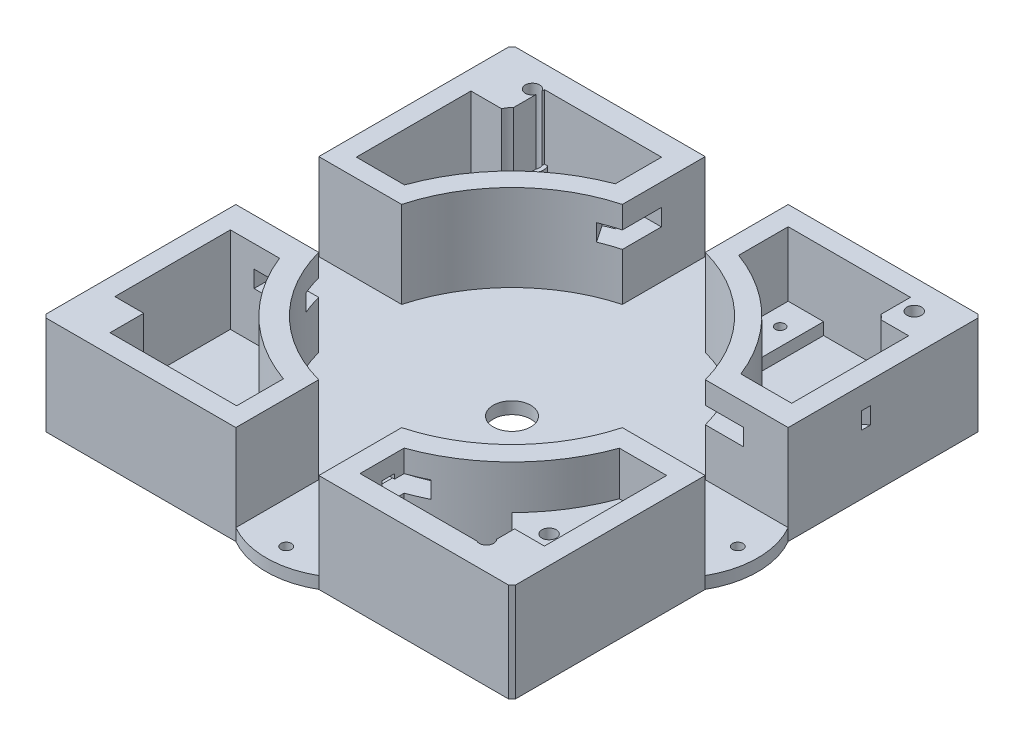
from build123d import *

# Parameters (mm, degrees)
BOSS_EXTRUDE1_DEPTH                  = 20.5
CUT_EXTRUDE4_REACH                   = 103.081
SKETCH2_R                            = 4.5
SKETCH2_R_2                          = 1.5
SKETCH2_R_3                          = 4.9
SKETCH2_R_4                          = 1
SKETCH2_R_5                          = 3.9
SKETCH2_R_6                          = 1.1
CUT_EXTRUDE7_START                   = -18
SKETCH3_R                            = 1.1
SKETCH3_R_2                          = 3.9
CUT_EXTRUDE7_DEPTH                   = 18
CUT_EXTRUDE8_START                   = -17.9
SKETCH4_R                            = 1.5
CUT_EXTRUDE8_DEPTH                   = 17.9
CUT_EXTRUDE9_START                   = -13.4
SKETCH5_R                            = 1.1
SKETCH5_R_2                          = 1
CUT_EXTRUDE9_DEPTH                   = 13.4
CUT_EXTRUDE10_START                  = -2.5
CUT_EXTRUDE10_DEPTH                  = 2.5
CUT_EXTRUDE11_START                  = -13.4
SKETCH7_R                            = 1
CUT_EXTRUDE11_DEPTH                  = 13.4
CUT_EXTRUDE12_START                  = -2.5
CUT_EXTRUDE12_DEPTH                  = 2.5
CUT_EXTRUDE13_START                  = -9.1
CUT_EXTRUDE13_DEPTH                  = 9.1
CUT_EXTRUDE14_START                  = -6.9
CUT_EXTRUDE14_DEPTH                  = 6.9
SKETCH11_W                           = 2.6
SKETCH11_H                           = 3.5
SKETCH11_W_2                         = 4.5
SKETCH11_H_2                         = 1
SKETCH11_W_3                         = 5.4
CUT_EXTRUDE15_DEPTH                  = 3.930835307
CUT_EXTRUDE16_REACH                  = 109.77
CUT_EXTRUDE16_END_RADIUS             = 32.7
SKETCH12_W                           = 6.7
SKETCH12_H                           = 3.5
CUT_EXTRUDE16_DIRECTION_2_REACH      = 109.77
CUT_EXTRUDE16_DIRECTION_2_END_RADIUS = 37.142307365
CUT_EXTRUDE17_REACH                  = 110.843
CUT_EXTRUDE17_END_RADIUS             = 37.142307365
SKETCH13_W                           = 6.720651518
SKETCH13_H                           = 3.5
SKETCH14_W                           = 8.3
SKETCH14_H                           = 3.5
CUT_EXTRUDE18_DEPTH                  = 5.130835307
CUT_EXTRUDE19_REACH                  = 121.1
CUT_EXTRUDE19_END_RADIUS             = 37.185548268
SKETCH15_W                           = 4.2
SKETCH15_H                           = 3.5
CUT_EXTRUDE19_DIRECTION_2_REACH      = 121.1
CUT_EXTRUDE19_DIRECTION_2_END_RADIUS = 32.7
CUT_EXTRUDE20_START                  = -0.335282018
CUT_EXTRUDE20_OUTLINE_W              = 1.5
CUT_EXTRUDE20_OUTLINE_H              = 3.5
CUT_EXTRUDE20_DEPTH                  = 2.439354416
CUT_EXTRUDE21_START                  = -0.459863
SKETCH17_W                           = 4.566599086
SKETCH17_H                           = 3.5
CUT_EXTRUDE21_DEPTH                  = 0.459863
CIRPATTERN1_START                    = 12.4
CIRPATTERN1_DEPTH                    = 3.5
SKETCH18_W                           = 8.1
SKETCH18_H                           = 3.5
CUT_EXTRUDE22_DEPTH                  = 4.430835307
CUT_EXTRUDE23_REACH                  = 83.159
SKETCH19_W                           = 7.9
SKETCH19_H                           = 3.5
BOSS_EXTRUDE2_DEPTH                  = 6.1
SPLIT1_START                         = 20.5
SPLIT1_DEPTH                         = 6.1


# Read off the part's stored shape, not the designer's step: Cut-Extrude20, CirPattern1, Split1
with BuildPart() as part:
    # Sketch1 → Boss-Extrude1 (new body)
    with BuildSketch(Plane(origin=(0, 0, 0), x_dir=(1, 0, 0), z_dir=(0, 1, 0))):
        with BuildLine():
            ThreePointArc((8.619164693, 15), (0, 17.3), (-8.619164693, 15))
            Line((-8.619164693, 15), (-48.05, 15))
            Line((-48.05, 15), (-48.75, 14.3))
            Line((-48.75, 14.3), (-48.75, -25.130835307))
            ThreePointArc((-48.75, -25.130835307), (-51.05, -33.75), (-48.75, -42.369164693))
            Line((-48.75, -42.369164693), (-48.75, -81.8))
            Line((-48.75, -81.8), (-48.05, -82.5))
            Line((-48.05, -82.5), (-8.619164693, -82.5))
            ThreePointArc((-8.619164693, -82.5), (0, -84.8), (8.619164693, -82.5))
            Line((8.619164693, -82.5), (48.05, -82.5))
            Line((48.05, -82.5), (48.75, -81.8))
            Line((48.75, -81.8), (48.75, -42.369164693))
            ThreePointArc((48.75, -42.369164693), (51.05, -33.75), (48.75, -25.130835307))
            Line((48.75, -25.130835307), (48.75, 14.3))
            Line((48.75, 14.3), (48.05, 15))
            Line((48.05, 15), (8.619164693, 15))
        make_face()
    extrude(amount=BOSS_EXTRUDE1_DEPTH)

    # Sketch2 → Cut-Extrude4 (cut, up to next)
    with BuildSketch(Plane.XZ, mode=Mode.PRIVATE) as cut_extrude4_sk1:
        with Locations(Location((35.25, 68.6, 0), (0, 0, 270))):
            Circle(SKETCH2_R)
    cut_extrude4_tool1 = extrude(cut_extrude4_sk1.sketch, amount=-CUT_EXTRUDE4_REACH, mode=Mode.PRIVATE) & part.part
    # Sketch2 → Cut-Extrude4 (cut, up to next)
    with BuildSketch(Plane.XZ, mode=Mode.PRIVATE) as cut_extrude4_sk2:
        with Locations(Location((33.95, 60, 0), (0, 0, 270))):
            Circle(SKETCH2_R_2)
    cut_extrude4_tool2 = extrude(cut_extrude4_sk2.sketch, amount=-CUT_EXTRUDE4_REACH, mode=Mode.PRIVATE) & part.part
    # Sketch2 → Cut-Extrude4 (cut, up to next)
    with BuildSketch(Plane.XZ, mode=Mode.PRIVATE) as cut_extrude4_sk3:
        with Locations(Location((35.05, -1, 0), (0, 0, 270))):
            Circle(SKETCH2_R_3)
    cut_extrude4_tool3 = extrude(cut_extrude4_sk3.sketch, amount=-CUT_EXTRUDE4_REACH, mode=Mode.PRIVATE) & part.part
    # Sketch2 → Cut-Extrude4 (cut, up to next)
    with BuildSketch(Plane.XZ, mode=Mode.PRIVATE) as cut_extrude4_sk4:
        with Locations(Location((-38.7, -9.2, 0), (0, 0, 270))):
            Circle(SKETCH2_R_2)
    cut_extrude4_tool4 = extrude(cut_extrude4_sk4.sketch, amount=-CUT_EXTRUDE4_REACH, mode=Mode.PRIVATE) & part.part
    # Sketch2 → Cut-Extrude4 (cut, up to next)
    with BuildSketch(Plane.XZ, mode=Mode.PRIVATE) as cut_extrude4_sk5:
        with Locations(Location((39.45, 17.4, 0), (0, 0, 270))):
            Circle(SKETCH2_R_4)
    cut_extrude4_tool5 = extrude(cut_extrude4_sk5.sketch, amount=-CUT_EXTRUDE4_REACH, mode=Mode.PRIVATE) & part.part
    # Sketch2 → Cut-Extrude4 (cut, up to next)
    with BuildSketch(Plane.XZ, mode=Mode.PRIVATE) as cut_extrude4_sk6:
        with Locations(Location((16.35, -5.6, 0), (0, 0, 270))):
            Circle(SKETCH2_R_4)
    cut_extrude4_tool6 = extrude(cut_extrude4_sk6.sketch, amount=-CUT_EXTRUDE4_REACH, mode=Mode.PRIVATE) & part.part
    # Sketch2 → Cut-Extrude4 (cut, up to next)
    with BuildSketch(Plane.XZ, mode=Mode.PRIVATE) as cut_extrude4_sk7:
        with Locations(Location((-15.75, -5.6, 0), (0, 0, 270))):
            Circle(SKETCH2_R_4)
    cut_extrude4_tool7 = extrude(cut_extrude4_sk7.sketch, amount=-CUT_EXTRUDE4_REACH, mode=Mode.PRIVATE) & part.part
    # Sketch2 → Cut-Extrude4 (cut, up to next)
    with BuildSketch(Plane.XZ, mode=Mode.PRIVATE) as cut_extrude4_sk8:
        with Locations(Location((-34.75, -1, 0), (0, 0, 270))):
            Circle(SKETCH2_R_5)
    cut_extrude4_tool8 = extrude(cut_extrude4_sk8.sketch, amount=-CUT_EXTRUDE4_REACH, mode=Mode.PRIVATE) & part.part
    # Sketch2 → Cut-Extrude4 (cut, up to next)
    with BuildSketch(Plane.XZ, mode=Mode.PRIVATE) as cut_extrude4_sk9:
        with Locations(Location((-39.05, 17.7, 0), (0, 0, 270))):
            Circle(SKETCH2_R_6)
    cut_extrude4_tool9 = extrude(cut_extrude4_sk9.sketch, amount=-CUT_EXTRUDE4_REACH, mode=Mode.PRIVATE) & part.part
    # Sketch2 → Cut-Extrude4 (cut, up to next)
    with BuildSketch(Plane.XZ, mode=Mode.PRIVATE) as cut_extrude4_sk10:
        with Locations(Location((0, 33.75, 0), (0, 0, 270))):
            Circle(SKETCH2_R_5)
    cut_extrude4_tool10 = extrude(cut_extrude4_sk10.sketch, amount=-CUT_EXTRUDE4_REACH, mode=Mode.PRIVATE) & part.part
    # Sketch2 → Cut-Extrude4 (cut, up to next)
    with BuildSketch(Plane.XZ, mode=Mode.PRIVATE) as cut_extrude4_sk11:
        with Locations(Location((0, -13.15, 0), (0, 0, 270))):
            Circle(SKETCH2_R_6)
    cut_extrude4_tool11 = extrude(cut_extrude4_sk11.sketch, amount=-CUT_EXTRUDE4_REACH, mode=Mode.PRIVATE) & part.part
    # Sketch2 → Cut-Extrude4 (cut, up to next)
    with BuildSketch(Plane.XZ, mode=Mode.PRIVATE) as cut_extrude4_sk12:
        with Locations(Location((40.91, -8.9, 0), (0, 0, 270))):
            Circle(SKETCH2_R_2)
    cut_extrude4_tool12 = extrude(cut_extrude4_sk12.sketch, amount=-CUT_EXTRUDE4_REACH, mode=Mode.PRIVATE) & part.part
    # Sketch2 → Cut-Extrude4 (cut, up to next)
    with BuildSketch(Plane.XZ, mode=Mode.PRIVATE) as cut_extrude4_sk13:
        with Locations(Location((46.9, 33.75, 0), (0, 0, 270))):
            Circle(SKETCH2_R_6)
    cut_extrude4_tool13 = extrude(cut_extrude4_sk13.sketch, amount=-CUT_EXTRUDE4_REACH, mode=Mode.PRIVATE) & part.part
    # Sketch2 → Cut-Extrude4 (cut, up to next)
    with BuildSketch(Plane.XZ, mode=Mode.PRIVATE) as cut_extrude4_sk14:
        with Locations(Location((0, 80.65, 0), (0, 0, 270))):
            Circle(SKETCH2_R_6)
    cut_extrude4_tool14 = extrude(cut_extrude4_sk14.sketch, amount=-CUT_EXTRUDE4_REACH, mode=Mode.PRIVATE) & part.part
    # Sketch2 → Cut-Extrude4 (cut, up to next)
    with BuildSketch(Plane.XZ, mode=Mode.PRIVATE) as cut_extrude4_sk15:
        with Locations(Location((-46.9, 33.75, 0), (0, 0, 270))):
            Circle(SKETCH2_R_6)
    cut_extrude4_tool15 = extrude(cut_extrude4_sk15.sketch, amount=-CUT_EXTRUDE4_REACH, mode=Mode.PRIVATE) & part.part
    # Sketch2 → Cut-Extrude4 (cut, up to next)
    with BuildSketch(Plane.XZ, mode=Mode.PRIVATE) as cut_extrude4_sk16:
        with Locations(Location((-36.3, 76.55, 0), (0, 0, 270))):
            Circle(SKETCH2_R_2)
    cut_extrude4_tool16 = extrude(cut_extrude4_sk16.sketch, amount=-CUT_EXTRUDE4_REACH, mode=Mode.PRIVATE) & part.part
    # Sketch2 → Cut-Extrude4 (cut, up to next)
    with BuildSketch(Plane.XZ, mode=Mode.PRIVATE) as cut_extrude4_sk17:
        with Locations(Location((37.5, 76.55, 0), (0, 0, 270))):
            Circle(SKETCH2_R_2)
    cut_extrude4_tool17 = extrude(cut_extrude4_sk17.sketch, amount=-CUT_EXTRUDE4_REACH, mode=Mode.PRIVATE) & part.part
    add(cut_extrude4_tool1.solids().sort_by_distance((35.25, 0, 68.6))[0], mode=Mode.SUBTRACT)
    add(cut_extrude4_tool2.solids().sort_by_distance((33.95, 0, 60))[0], mode=Mode.SUBTRACT)
    add(cut_extrude4_tool3.solids().sort_by_distance((35.05, 0, -1))[0], mode=Mode.SUBTRACT)
    add(cut_extrude4_tool4.solids().sort_by_distance((-38.7, 0, -9.2))[0], mode=Mode.SUBTRACT)
    add(cut_extrude4_tool5.solids().sort_by_distance((39.45, 0, 17.4))[0], mode=Mode.SUBTRACT)
    add(cut_extrude4_tool6.solids().sort_by_distance((16.35, 0, -5.6))[0], mode=Mode.SUBTRACT)
    add(cut_extrude4_tool7.solids().sort_by_distance((-15.75, 0, -5.6))[0], mode=Mode.SUBTRACT)
    add(cut_extrude4_tool8.solids().sort_by_distance((-34.75, 0, -1))[0], mode=Mode.SUBTRACT)
    add(cut_extrude4_tool9.solids().sort_by_distance((-39.05, 0, 17.7))[0], mode=Mode.SUBTRACT)
    add(cut_extrude4_tool10.solids().sort_by_distance((0, 0, 33.75))[0], mode=Mode.SUBTRACT)
    add(cut_extrude4_tool11.solids().sort_by_distance((0, 0, -13.15))[0], mode=Mode.SUBTRACT)
    add(cut_extrude4_tool12.solids().sort_by_distance((40.91, 0, -8.9))[0], mode=Mode.SUBTRACT)
    add(cut_extrude4_tool13.solids().sort_by_distance((46.9, 0, 33.75))[0], mode=Mode.SUBTRACT)
    add(cut_extrude4_tool14.solids().sort_by_distance((0, 0, 80.65))[0], mode=Mode.SUBTRACT)
    add(cut_extrude4_tool15.solids().sort_by_distance((-46.9, 0, 33.75))[0], mode=Mode.SUBTRACT)
    add(cut_extrude4_tool16.solids().sort_by_distance((-36.3, 0, 76.55))[0], mode=Mode.SUBTRACT)
    add(cut_extrude4_tool17.solids().sort_by_distance((37.5, 0, 76.55))[0], mode=Mode.SUBTRACT)

    # Sketch3 → Cut-Extrude7 (cut)
    with BuildSketch(Plane(origin=(0, 20.5, 0), x_dir=(1, 0, 0), z_dir=(0, 1, 0)).offset(CUT_EXTRUDE7_START)):
        with BuildLine():
            Line((8.619164693, -2.206379409), (8.619164693, 15))
            ThreePointArc((8.619164693, 15), (0, 17.3), (-8.619164693, 15))
            Line((-8.619164693, 15), (-8.619164693, -2.206379409))
            ThreePointArc((-8.619164693, -2.206379409), (-23.122391745, -10.627608255), (-31.543620591, -25.130835307))
            Line((-31.543620591, -25.130835307), (-48.75, -25.130835307))
            ThreePointArc((-48.75, -25.130835307), (-51.05, -33.75), (-48.75, -42.369164693))
            Line((-48.75, -42.369164693), (-31.543620591, -42.369164693))
            ThreePointArc((-31.543620591, -42.369164693), (-23.122391745, -56.872391745), (-8.619164693, -65.293620591))
            Line((-8.619164693, -65.293620591), (-8.619164693, -82.5))
            ThreePointArc((-8.619164693, -82.5), (0, -84.8), (8.619164693, -82.5))
            Line((8.619164693, -82.5), (8.619164693, -65.293620591))
            ThreePointArc((8.619164693, -65.293620591), (23.122391745, -56.872391745), (31.543620591, -42.369164693))
            Line((31.543620591, -42.369164693), (48.75, -42.369164693))
            ThreePointArc((48.75, -42.369164693), (51.05, -33.75), (48.75, -25.130835307))
            Line((48.75, -25.130835307), (31.543620591, -25.130835307))
            ThreePointArc((31.543620591, -25.130835307), (23.122391745, -10.627608255), (8.619164693, -2.206379409))
        make_face()
        with Locations(Location((0, -80.65, 0), (0, 0, 90))):
            Circle(SKETCH3_R, mode=Mode.SUBTRACT)
        with Locations(Location((-46.9, -33.75, 0), (0, 0, 90))):
            Circle(SKETCH3_R, mode=Mode.SUBTRACT)
        with Locations(Location((0, -33.75, 0), (0, 0, 90))):
            Circle(SKETCH3_R_2, mode=Mode.SUBTRACT)
        with Locations(Location((46.9, -33.75, 0), (0, 0, 90))):
            Circle(SKETCH3_R, mode=Mode.SUBTRACT)
        with Locations(Location((0, 13.15, 0), (0, 0, 90))):
            Circle(SKETCH3_R, mode=Mode.SUBTRACT)
    extrude(amount=CUT_EXTRUDE7_DEPTH, mode=Mode.SUBTRACT)

    # Sketch4 → Cut-Extrude8 (cut)
    with BuildSketch(Plane(origin=(0, 20.5, 0), x_dir=(1, 0, 0), z_dir=(0, 1, 0)).offset(CUT_EXTRUDE8_START)):
        with BuildLine():
            Line((-34.55, -47.5), (-44.75, -47.5))
            Line((-44.75, -47.5), (-44.75, -71.5))
            Line((-44.75, -71.5), (-38.75, -71.5))
            Line((-38.75, -71.5), (-38.75, -78.5))
            Line((-38.75, -78.5), (-12.45, -78.5))
            Line((-12.45, -78.5), (-12.45, -68.789442062))
            ThreePointArc((-12.45, -68.789442062), (-25.798451229, -60.530681735), (-34.55, -47.5))
        make_face()
        with Locations(Location((-36.3, -76.55, 0), (0, 0, 90))):
            Circle(SKETCH4_R, mode=Mode.SUBTRACT)
    extrude(amount=CUT_EXTRUDE8_DEPTH, mode=Mode.SUBTRACT)

    # Sketch5 → Cut-Extrude9 (cut)
    with BuildSketch(Plane(origin=(0, 20.5, 0), x_dir=(1, 0, 0), z_dir=(0, 1, 0)).offset(CUT_EXTRUDE9_START)):
        with BuildLine():
            ThreePointArc((-34.75, -21.332579186), (-26.33082794, -7.895748131), (-13.05, 0.767420814))
            Line((-13.05, 0.767420814), (-13.05, 10.367420814))
            Line((-13.05, 10.367420814), (-37.35, 10.367420814))
            Line((-37.35, 10.367420814), (-37.35, 9.853834842))
            ThreePointArc((-37.35, 9.853834842), (-37.237980848, 9.535410197), (-37.2, 9.2))
            ThreePointArc((-37.2, 9.2), (-37.237980848, 8.864589803), (-37.35, 8.546165158))
            Line((-37.35, 8.546165158), (-37.35, 3.906888371))
            ThreePointArc((-37.35, 3.906888371), (-33.157831667, 4.560196624), (-30.85, 1))
            ThreePointArc((-30.85, 1), (-35.497573089, -2.827680039), (-38.363402296, 2.467420814))
            Line((-38.363402296, 2.467420814), (-44.75, 2.467420814))
            Line((-44.75, 2.467420814), (-44.75, -21.332579186))
            Line((-44.75, -21.332579186), (-34.75, -21.332579186))
        make_face()
        with Locations(Location((-39.05, -17.7, 0), (0, 0, 90))):
            Circle(SKETCH5_R, mode=Mode.SUBTRACT)
        with Locations(Location((-15.75, 5.6, 0), (0, 0, 90))):
            Circle(SKETCH5_R_2, mode=Mode.SUBTRACT)
    extrude(amount=CUT_EXTRUDE9_DEPTH, mode=Mode.SUBTRACT)

    # Sketch6 → Cut-Extrude10 (cut)
    with BuildSketch(Plane(origin=(0, 7.1, 0), x_dir=(1, 0, 0), z_dir=(0, 1, 0)).offset(CUT_EXTRUDE10_START)):
        with BuildLine():
            Line((-44.75, -15.332579186), (-31.977389672, -15.332579186))
            ThreePointArc((-31.977389672, -15.332579186), (-26.065200886, -7.627975912), (-18.347741116, -1.732579186))
            Line((-18.347741116, -1.732579186), (-18.347741116, 10.367420814))
            Line((-18.347741116, 10.367420814), (-36.710416793, 10.367420814))
            ThreePointArc((-36.710416793, 10.367420814), (-36.442687006, 8.724762434), (-37.35, 7.329488654))
            Line((-37.35, 7.329488654), (-37.35, 3.906888371))
            ThreePointArc((-37.35, 3.906888371), (-37.938982398, 3.245081572), (-38.363402296, 2.467420814))
            Line((-38.363402296, 2.467420814), (-44.75, 2.467420814))
            Line((-44.75, 2.467420814), (-44.75, -15.332579186))
        make_face()
    extrude(amount=CUT_EXTRUDE10_DEPTH, mode=Mode.SUBTRACT)

    # Sketch7 → Cut-Extrude11 (cut)
    with BuildSketch(Plane(origin=(0, 20.5, 0), x_dir=(1, 0, 0), z_dir=(0, 1, 0)).offset(CUT_EXTRUDE11_START)):
        with BuildLine():
            Line((34.185779207, -20.4), (44.75, -20.4))
            Line((44.75, -20.4), (44.75, 3.9))
            Line((44.75, 3.9), (38.999683532, 3.9))
            ThreePointArc((38.999683532, 3.9), (39.706363887, 2.525868719), (39.95, 1))
            ThreePointArc((39.95, 1), (30.659162552, -1.174981955), (38.019164693, 4.897956006))
            Line((38.019164693, 4.897956006), (38.019164693, 11))
            Line((38.019164693, 11), (12.619164693, 11))
            Line((12.619164693, 11), (12.619164693, 0.712250107))
            ThreePointArc((12.619164693, 0.712250107), (25.67308843, -7.524391704), (34.185779207, -20.4))
        make_face()
        with Locations(Location((39.45, -17.4, 0), (0, 0, 90))):
            Circle(SKETCH7_R, mode=Mode.SUBTRACT)
        with Locations(Location((16.35, 5.6, 0), (0, 0, 90))):
            Circle(SKETCH7_R, mode=Mode.SUBTRACT)
    extrude(amount=CUT_EXTRUDE11_DEPTH, mode=Mode.SUBTRACT)

    # Sketch8 → Cut-Extrude12 (cut)
    with BuildSketch(Plane(origin=(0, 7.1, 0), x_dir=(1, 0, 0), z_dir=(0, 1, 0)).offset(CUT_EXTRUDE12_START)):
        with BuildLine():
            Line((19.975913663, 11), (19.975913663, -2.962780682))
            ThreePointArc((19.975913663, -2.962780682), (25.577733832, -7.431384307), (30.204428985, -12.903358312))
            Line((30.204428985, -12.903358312), (44.75, -12.903358312))
            Line((44.75, -12.903358312), (44.75, 3.9))
            Line((44.75, 3.9), (38.999683532, 3.9))
            ThreePointArc((38.999683532, 3.9), (38.54522449, 4.434152845), (38.019164693, 4.897956006))
            Line((38.019164693, 4.897956006), (38.019164693, 11))
            Line((38.019164693, 11), (19.975913663, 11))
        make_face()
    extrude(amount=CUT_EXTRUDE12_DEPTH, mode=Mode.SUBTRACT)

    # Sketch9 → Cut-Extrude13 (cut)
    with BuildSketch(Plane(origin=(0, 20.5, 0), x_dir=(1, 0, 0), z_dir=(0, 1, 0)).offset(CUT_EXTRUDE13_START)):
        with BuildLine():
            Line((44.75, -46.369164693), (44.75, -71.769164693))
            Line((44.75, -71.769164693), (38.559280517, -71.769164693))
            Line((38.559280517, -71.769164693), (38.559280517, -75.487961966))
            ThreePointArc((38.559280517, -75.487961966), (38.703665771, -77.445091455), (36.787801623, -77.870141459))
            Line((36.787801623, -77.870141459), (12.55, -77.870141459))
            Line((12.55, -77.870141459), (12.55, -68.707810235))
            ThreePointArc((12.55, -68.707810235), (26.237573806, -60.039555287), (34.932902526, -46.369164693))
            Line((34.932902526, -46.369164693), (44.75, -46.369164693))
        make_face()
    extrude(amount=CUT_EXTRUDE13_DEPTH, mode=Mode.SUBTRACT)

    # Sketch10 → Cut-Extrude14 (cut)
    with BuildSketch(Plane(origin=(0, 11.4, 0), x_dir=(1, 0, 0), z_dir=(0, 1, 0)).offset(CUT_EXTRUDE14_START)):
        with BuildLine():
            Line((38.559280517, -76.128477272), (38.559280517, -72.269164693))
            Line((38.559280517, -72.269164693), (26.277242845, -59.999904854))
            ThreePointArc((26.277242845, -59.999904854), (19.895868937, -65.114078109), (12.55, -68.707810235))
            Line((12.55, -68.707810235), (12.55, -77.870141459))
            Line((12.55, -77.870141459), (36.787801623, -77.870141459))
            Line((36.787801623, -77.870141459), (38.559280517, -76.128477272))
        make_face()
    extrude(amount=CUT_EXTRUDE14_DEPTH, mode=Mode.SUBTRACT)

    # Sketch11 → Cut-Extrude15 (cut)
    with BuildSketch(Plane.ZY.offset(-8.619164693)):
        with Locations((71.993620591, 14.15)):
            Rectangle(SKETCH11_W, SKETCH11_H)
        with Locations((75.543620591, 14.15)):
            Rectangle(SKETCH11_W_2, SKETCH11_H)
        with Locations((71.993620591, 16.4)):
            Rectangle(SKETCH11_W, SKETCH11_H_2)
        with Locations((71.993620591, 11.9)):
            Rectangle(SKETCH11_W, SKETCH11_H_2)
        with Locations((67.993620591, 14.15)):
            Rectangle(SKETCH11_W_3, SKETCH11_H)
    extrude(amount=-CUT_EXTRUDE15_DEPTH, mode=Mode.SUBTRACT)

    # Cut-Extrude16: up to this cylinder (the profile starts outside it)
    cut_extrude16_end = Plane(origin=(0, 14.15, 33.75), z_dir=(0, 1, 0)) * Cylinder(CUT_EXTRUDE16_END_RADIUS, 285.94, mode=Mode.PRIVATE)
    # Sketch12 → Cut-Extrude16 (cut, up to the surface)
    with BuildSketch(Plane(origin=(18.670978955, 0, 62.280186916), x_dir=(0.9578816239684772, 0, -0.2871633584974115), z_dir=(0.2871633584974115, 0, 0.9578816239684772)), mode=Mode.PRIVATE) as cut_extrude16_sk1:
        with Locations((-7.143795904, 14.15)):
            Rectangle(SKETCH12_W, SKETCH12_H)
    cut_extrude16_tool1 = extrude(cut_extrude16_sk1.sketch, amount=-CUT_EXTRUDE16_REACH, mode=Mode.PRIVATE) - cut_extrude16_end
    add(cut_extrude16_tool1.solids().sort_by_distance((11.828068, 14.15, 64.331623))[0], mode=Mode.SUBTRACT)

    # Cut-Extrude16 direction 2: up to this cylinder (the profile starts inside it)
    cut_extrude16_direction_2_end = Plane(origin=(0, 14.15, 33.75), z_dir=(0, 1, 0)) * Cylinder(CUT_EXTRUDE16_DIRECTION_2_END_RADIUS, 294.82461473, mode=Mode.PRIVATE)
    # Sketch12 → Cut-Extrude16 direction 2 (cut, up to the surface)
    with BuildSketch(Plane(origin=(18.670978955, 0, 62.280186916), x_dir=(0.9578816239684772, 0, -0.2871633584974115), z_dir=(0.2871633584974115, 0, 0.9578816239684772)), mode=Mode.PRIVATE) as cut_extrude16_direction_2_sk1:
        with Locations((-7.143795904, 14.15)):
            Rectangle(SKETCH12_W, SKETCH12_H)
    cut_extrude16_direction_2_tool1 = extrude(cut_extrude16_direction_2_sk1.sketch, amount=CUT_EXTRUDE16_DIRECTION_2_REACH, mode=Mode.PRIVATE) & cut_extrude16_direction_2_end
    add(cut_extrude16_direction_2_tool1.solids().sort_by_distance((11.828068, 14.15, 64.331623))[0], mode=Mode.SUBTRACT)

    # Cut-Extrude17: up to this cylinder (the profile starts inside it)
    cut_extrude17_end = Plane(origin=(0, 14.15, 33.75), z_dir=(0, 1, 0)) * Cylinder(CUT_EXTRUDE17_END_RADIUS, 296.97061473, mode=Mode.PRIVATE)
    # Sketch13 → Cut-Extrude17 (cut, up to the surface)
    with BuildSketch(Plane(origin=(23.123076433, 0, 59.673448317), x_dir=(-0.9324434908884547, 3.4374963292630897e-15, 0.361315840089737), z_dir=(-0.361315840089737, -7.394430233901567e-15, -0.9324434908884547)), mode=Mode.PRIVATE) as cut_extrude17_sk1:
        with Locations((12.194409603, 14.15)):
            Rectangle(SKETCH13_W, SKETCH13_H)
    cut_extrude17_tool1 = extrude(cut_extrude17_sk1.sketch, amount=-CUT_EXTRUDE17_REACH, mode=Mode.PRIVATE) & cut_extrude17_end
    add(cut_extrude17_tool1.solids().sort_by_distance((11.752479, 14.15, 64.079482))[0], mode=Mode.SUBTRACT)

    # Sketch14 → Cut-Extrude18 (cut)
    with BuildSketch(Plane(origin=(0, 0, 42.369164693), x_dir=(-1, 0, 0), z_dir=(0, 0, -1))):
        with Locations((35.693620591, 14.15)):
            Rectangle(SKETCH14_W, SKETCH14_H)
    extrude(amount=-CUT_EXTRUDE18_DEPTH, mode=Mode.SUBTRACT)

    # Cut-Extrude19: up to this cylinder (the profile starts inside it)
    cut_extrude19_end = Plane(origin=(0, 14.15, 33.75), z_dir=(0, 1, 0)) * Cylinder(CUT_EXTRUDE19_END_RADIUS, 317.571096536, mode=Mode.PRIVATE)
    # Sketch15 → Cut-Extrude19 (cut, up to the surface)
    with BuildSketch(Plane(origin=(-40.124958259, 0, 10.963979944), x_dir=(-0.2635830181255845, 0, -0.9646367153264529), z_dir=(0.9646367153264529, 0, -0.2635830181255845)), mode=Mode.PRIVATE) as cut_extrude19_sk1:
        with Locations((-34.656489142, 14.15)):
            Rectangle(SKETCH15_W, SKETCH15_H)
    cut_extrude19_tool1 = extrude(cut_extrude19_sk1.sketch, amount=-CUT_EXTRUDE19_REACH, mode=Mode.PRIVATE) & cut_extrude19_end
    add(cut_extrude19_tool1.solids().sort_by_distance((-30.990096, 14.15, 44.394902))[0], mode=Mode.SUBTRACT)

    # Cut-Extrude19 direction 2: up to this cylinder (the profile starts outside it)
    cut_extrude19_direction_2_end = Plane(origin=(0, 14.15, 33.75), z_dir=(0, 1, 0)) * Cylinder(CUT_EXTRUDE19_DIRECTION_2_END_RADIUS, 308.6, mode=Mode.PRIVATE)
    # Sketch15 → Cut-Extrude19 direction 2 (cut, up to the surface)
    with BuildSketch(Plane(origin=(-40.124958259, 0, 10.963979944), x_dir=(-0.2635830181255845, 0, -0.9646367153264529), z_dir=(0.9646367153264529, 0, -0.2635830181255845)), mode=Mode.PRIVATE) as cut_extrude19_direction_2_sk1:
        with Locations((-34.656489142, 14.15)):
            Rectangle(SKETCH15_W, SKETCH15_H)
    cut_extrude19_direction_2_tool1 = extrude(cut_extrude19_direction_2_sk1.sketch, amount=CUT_EXTRUDE19_DIRECTION_2_REACH, mode=Mode.PRIVATE) - cut_extrude19_direction_2_end
    add(cut_extrude19_direction_2_tool1.solids().sort_by_distance((-30.990096, 14.15, 44.394902))[0], mode=Mode.SUBTRACT)

    # Cut-Extrude20 outline → Cut-Extrude20 (cut)
    with BuildSketch(Plane(origin=(-45.359698084, 0, 32.337075086), x_dir=(-0.5804925454635855, 0, -0.8142655615100071), z_dir=(0.8142655615100071, 0, -0.5804925454635855)).offset(CUT_EXTRUDE20_START)):
        with Locations((-19.371596726, 14.15)):
            Rectangle(CUT_EXTRUDE20_OUTLINE_W, CUT_EXTRUDE20_OUTLINE_H)
    extrude(amount=CUT_EXTRUDE20_DEPTH, mode=Mode.SUBTRACT)

    # Sketch17 → Cut-Extrude21 (cut)
    with BuildSketch(Plane(origin=(12.013793469, 0, 17.678069929), x_dir=(0.8270851515503499, 0, -0.5620766425363494), z_dir=(0.5620766425363494, 1.6397303188871124e-15, 0.8270851515503499)).offset(CUT_EXTRUDE21_START)):
        with Locations((-53.292674909, 14.15)):
            Rectangle(SKETCH17_W, SKETCH17_H)
    extrude(amount=CUT_EXTRUDE21_DEPTH, mode=Mode.SUBTRACT)

    # CirPattern1 outline → CirPattern1 (cut)
    with BuildSketch(Plane(origin=(0, 0, 0), x_dir=(1, 0, 0), z_dir=(0, 1, 0)).offset(CIRPATTERN1_START)):
        with BuildLine():
            Line((31.543620591, -25.130835307), (35.870545139, -23.948520957))
            ThreePointArc((35.870545139, -23.948520957), (35.333107925, -22.159638299), (34.70651956, -20.4))
            Line((34.70651956, -20.4), (34.185779207, -20.4))
            ThreePointArc((34.185779207, -20.4), (33.873745233, -19.626990977), (33.544234597, -18.861268514))
            Line((33.544234597, -18.861268514), (30.175303486, -21.150751628))
            ThreePointArc((30.175303486, -21.150751628), (30.923561629, -23.118756603), (31.543620591, -25.130835307))
        make_face()
        Polygon((44.75, -10.886236242), (44.75, -12.728387097), (48.75, -9.876774194), (48.75, -8.034623339), align=None)
        with BuildLine():
            Line((-8.619164693, -2.206379409), (-9.801479043, 2.120545139))
            ThreePointArc((-9.801479043, 2.120545139), (-11.437797336, 1.63278949), (-13.05, 1.07043222))
            Line((-13.05, 1.07043222), (-13.05, 0.767420814))
            ThreePointArc((-13.05, 0.767420814), (-14.0327944, 0.379686799), (-15.004086201, -0.036023122))
            Line((-15.004086201, -0.036023122), (-12.599248372, -3.574696514))
            ThreePointArc((-12.599248372, -3.574696514), (-10.631243397, -2.826438371), (-8.619164693, -2.206379409))
        make_face()
    extrude(amount=CIRPATTERN1_DEPTH, mode=Mode.SUBTRACT)

    # Sketch18 → Cut-Extrude22 (cut)
    with BuildSketch(Plane(origin=(-8.619164693, 0, 0), x_dir=(0, 0, -1), z_dir=(1, 0, 0))):
        with Locations((1.843620591, 14.15)):
            Rectangle(SKETCH18_W, SKETCH18_H)
    extrude(amount=-CUT_EXTRUDE22_DEPTH, mode=Mode.SUBTRACT)

    # Cut-Extrude23: up to this face of the body (flat: up to its plane)
    cut_extrude23_end = Plane(part.part.faces().sort_by_distance((46.75, 14.15, 11.302580646))[0])
    # Sketch19 → Cut-Extrude23 (cut, up to the picked face)
    with BuildSketch(Plane.XY.offset(25.130835307), mode=Mode.PRIVATE) as cut_extrude23_sk1:
        with Locations((35.493620591, 14.15)):
            Rectangle(SKETCH19_W, SKETCH19_H)
    cut_extrude23_tool1 = split(extrude(cut_extrude23_sk1.sketch, amount=-CUT_EXTRUDE23_REACH, mode=Mode.PRIVATE), bisect_by=cut_extrude23_end, keep=Keep.BOTH, mode=Mode.PRIVATE)
    add(cut_extrude23_tool1.solids().sort_by(Axis((35.493621, 14.15, 25.130835), (0, 0, -1)))[0], mode=Mode.SUBTRACT)

    # Sketch20 → Boss-Extrude2 (add)
    with BuildSketch(Plane(origin=(0, 20.5, 0), x_dir=(1, 0, 0), z_dir=(0, 1, 0))):
        with BuildLine():
            Line((42.05, -76.069164693), (50.55, -76.069164693))
            Line((50.55, -76.069164693), (50.55, -83.419164693))
            ThreePointArc((50.55, -83.419164693), (50.213172798, -84.232337491), (49.4, -84.569164693))
            Line((49.4, -84.569164693), (42.05, -84.569164693))
            Line((42.05, -84.569164693), (42.05, -76.069164693))
        make_face()
        with BuildLine():
            Line((41.819164693, 16.3), (49.119164693, 16.3))
            ThreePointArc((49.119164693, 16.3), (49.96769283, 15.948528137), (50.319164693, 15.1))
            Line((50.319164693, 15.1), (50.319164693, 7.8))
            Line((50.319164693, 7.8), (41.819164693, 7.8))
            Line((41.819164693, 7.8), (41.819164693, 16.3))
        make_face()
        with BuildLine():
            Line((-41.55, 15.667420814), (-48.9, 15.667420814))
            ThreePointArc((-48.9, 15.667420814), (-49.713172798, 15.330593613), (-50.05, 14.517420814))
            Line((-50.05, 14.517420814), (-50.05, 7.167420814))
            Line((-50.05, 7.167420814), (-41.55, 7.167420814))
            Line((-41.55, 7.167420814), (-41.55, 15.667420814))
        make_face()
        with BuildLine():
            Line((-41.55, -76.2), (-50.05, -76.2))
            Line((-50.05, -76.2), (-50.05, -83.55))
            ThreePointArc((-50.05, -83.55), (-49.713172798, -84.363172798), (-48.9, -84.7))
            Line((-48.9, -84.7), (-41.55, -84.7))
            Line((-41.55, -84.7), (-41.55, -76.2))
        make_face()
    extrude(amount=BOSS_EXTRUDE2_DEPTH)

    # Split1 outline → Split1 (cut)
    with BuildSketch(Plane(origin=(0, 0, 0), x_dir=(1, 0, 0), z_dir=(0, 1, 0)).offset(SPLIT1_START)):
        with BuildLine():
            Line((42.05, -76.069164693), (42.05, -84.569164693))
            Line((42.05, -84.569164693), (49.4, -84.569164693))
            ThreePointArc((49.4, -84.569164693), (50.213172798, -84.232337491), (50.55, -83.419164693))
            Line((50.55, -83.419164693), (50.55, -76.069164693))
            Line((50.55, -76.069164693), (42.05, -76.069164693))
        make_face()
        with BuildLine():
            Line((41.819164693, 16.3), (41.819164693, 7.8))
            Line((41.819164693, 7.8), (50.319164693, 7.8))
            Line((50.319164693, 7.8), (50.319164693, 15.1))
            ThreePointArc((50.319164693, 15.1), (49.96769283, 15.948528137), (49.119164693, 16.3))
            Line((49.119164693, 16.3), (41.819164693, 16.3))
        make_face()
        with BuildLine():
            Line((-41.55, 7.167420814), (-41.55, 15.667420814))
            Line((-41.55, 15.667420814), (-48.9, 15.667420814))
            ThreePointArc((-48.9, 15.667420814), (-49.713172798, 15.330593613), (-50.05, 14.517420814))
            Line((-50.05, 14.517420814), (-50.05, 7.167420814))
            Line((-50.05, 7.167420814), (-41.55, 7.167420814))
        make_face()
        with BuildLine():
            Line((-41.55, -84.7), (-41.55, -76.2))
            Line((-41.55, -76.2), (-50.05, -76.2))
            Line((-50.05, -76.2), (-50.05, -83.55))
            ThreePointArc((-50.05, -83.55), (-49.713172798, -84.363172798), (-48.9, -84.7))
            Line((-48.9, -84.7), (-41.55, -84.7))
        make_face()
    extrude(amount=SPLIT1_DEPTH, mode=Mode.SUBTRACT)


solid = part.part
